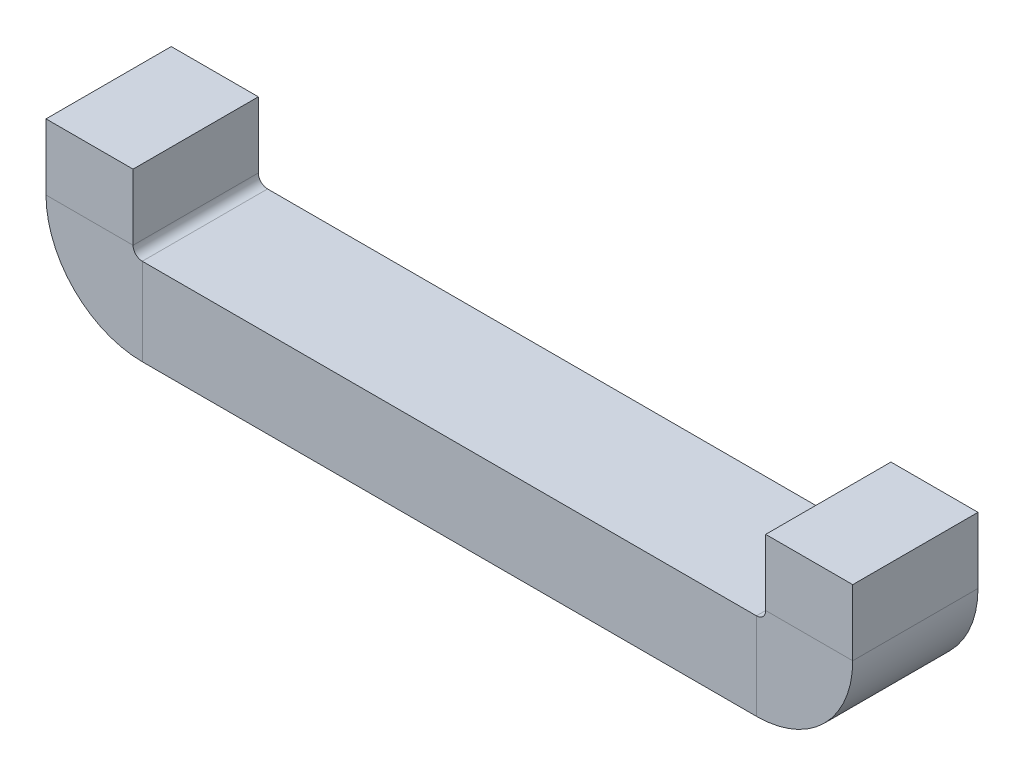
from build123d import *

# Parameters (mm, degrees)
SKETCH_2_W                         = 50.5
SKETCH_2_H                         = 10
SM_BASE_FLANGE_1_DEPTH             = 6.95
SM_EDGE_FLANGE_1_STRIP_W           = 29.2732
SM_EDGE_FLANGE_1_STRIP_H           = 6.95
SM_EDGE_FLANGE_1_STRIP_CUT_DEPTH   = 10
SM_EDGE_FLANGE_1_STRIP_2_W         = 29.2732
SM_EDGE_FLANGE_1_STRIP_2_H         = 6.95
SM_EDGE_FLANGE_1_STRIP_CUT_2_DEPTH = 10
SM_EDGE_FLANGE_1_DEPTH             = 10
SM_EDGE_FLANGE_1_BEND_DEPTH        = 10


# Sheet-metal steps are written as plain solids
with BuildPart() as part:
    # Эскиз2 → Базовая кромка1 (new body)
    with BuildSketch(Plane(origin=(0, 0, 0), x_dir=(1, 0, 0), z_dir=(0, 1, 0))):
        Rectangle(SKETCH_2_W, SKETCH_2_H)
    extrude(amount=-SM_BASE_FLANGE_1_DEPTH)

    # Ребро-кромка1 strip (across the edge) → Ребро-кромка1 strip cut (cut)
    with BuildSketch(Plane(origin=(-25.25, 0, -5), x_dir=(1, 0, 0), z_dir=(0, 0, 1))):
        with Locations((-13.9, -3.475)):
            Rectangle(SM_EDGE_FLANGE_1_STRIP_W, SM_EDGE_FLANGE_1_STRIP_H)
    extrude(amount=SM_EDGE_FLANGE_1_STRIP_CUT_DEPTH, mode=Mode.SUBTRACT)

    # Ребро-кромка1 strip 2 (across the edge) → Ребро-кромка1 strip cut 2 (cut)
    with BuildSketch(Plane(origin=(25.25, 0, 5), x_dir=(-1, 0, 0), z_dir=(0, 0, -1))):
        with Locations((-13.9, -3.475)):
            Rectangle(SM_EDGE_FLANGE_1_STRIP_2_W, SM_EDGE_FLANGE_1_STRIP_2_H)
    extrude(amount=SM_EDGE_FLANGE_1_STRIP_CUT_2_DEPTH, mode=Mode.SUBTRACT)

    # Ребро-кромка1 section (across the edge) → Ребро-кромка1 (add)
    with BuildSketch(Plane(origin=(-25.25, 0, -5), x_dir=(1, 0, 0), z_dir=(0, 0, 1))):
        with BuildLine():
            Line((-6.95, 0.7366), (-6.95, 6))
            Line((-6.95, 6), (0, 6))
            Line((0, 6), (0, 0.7366))
            ThreePointArc((0, 0.7366), (0.215745145, 0.215745145), (0.7366, 0))
            Line((0.7366, 0), (0.7366, -6.95))
            ThreePointArc((0.7366, -6.95), (-4.698646984, -4.698646984), (-6.95, 0.7366))
        make_face()
    extrude(amount=SM_EDGE_FLANGE_1_DEPTH)

    # Ребро-кромка1 section 2 (across the edge) → Ребро-кромка1 bend (add)
    with BuildSketch(Plane(origin=(25.25, 0, 5), x_dir=(-1, 0, 0), z_dir=(0, 0, -1))):
        with BuildLine():
            Line((-6.95, 0.7366), (-6.95, 6))
            Line((-6.95, 6), (0, 6))
            Line((0, 6), (0, 0.7366))
            ThreePointArc((0, 0.7366), (0.215745145, 0.215745145), (0.7366, 0))
            Line((0.7366, 0), (0.7366, -6.95))
            ThreePointArc((0.7366, -6.95), (-4.698646984, -4.698646984), (-6.95, 0.7366))
        make_face()
    extrude(amount=SM_EDGE_FLANGE_1_BEND_DEPTH)


solid = part.part
